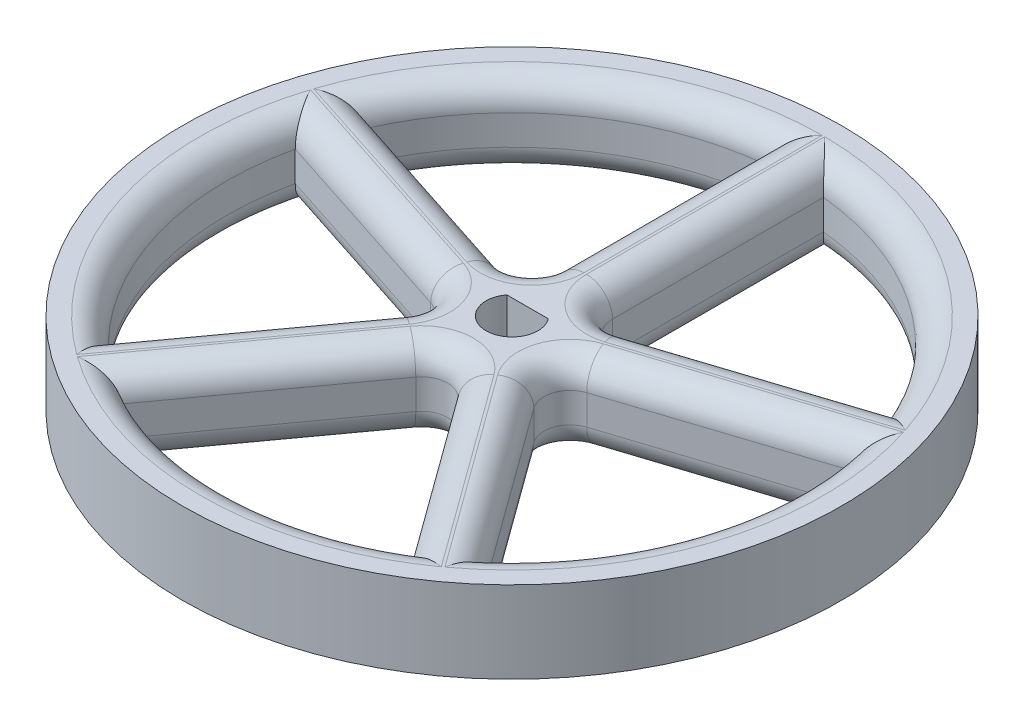
from build123d import *

# Parameters (mm, degrees)
SKETCH4_R           = 25.4
BOSS_EXTRUDE4_DEPTH = 6.3
FILLET6_R           = 2
FILLET7_R           = 2


with BuildPart() as part:
    # Sketch4 → Boss-Extrude4 (new body)
    with BuildSketch(Plane(origin=(0, 0, 0), x_dir=(1, 0, 0), z_dir=(0, 1, 0))):
        with Locations((-0.674307, 0)):
            Circle(SKETCH4_R)
        with BuildLine():
            Line((-0.674307, 1.2), (-2.274307, 1.2))
            ThreePointArc((-2.274307, 1.2), (-0.674307, -2), (0.925693, 1.2))
            Line((0.925693, 1.2), (-0.674307, 1.2))
        make_face(mode=Mode.SUBTRACT)
        with BuildLine():
            Line((-2.773413, 5.641936), (-2.773413, 21.899629))
            ThreePointArc((-2.773413, 21.899629), (-13.605582, 17.798374), (-20.853432, 8.763727))
            Line((-20.853432, 8.763727), (-5.391447, 3.739823))
            ThreePointArc((-5.391447, 3.739823), (-3.597843, 4.023902), (-2.773413, 5.641936))
        make_face(mode=Mode.SUBTRACT)
        with BuildLine():
            Line((1.4248, 5.641936), (1.4248, 21.899629))
            ThreePointArc((1.4248, 21.899629), (12.256969, 17.798374), (19.504819, 8.763727))
            Line((19.504819, 8.763727), (4.042834, 3.739823))
            ThreePointArc((4.042834, 3.739823), (2.24923, 4.023902), (1.4248, 5.641936))
        make_face(mode=Mode.SUBTRACT)
        with BuildLine():
            Line((5.340153, -0.252915), (20.802138, 4.770988))
            ThreePointArc((20.802138, 4.770988), (20.248937, -6.798374), (13.896185, -16.483348))
            Line((13.896185, -16.483348), (4.340153, -3.330598))
            ThreePointArc((4.340153, -3.330598), (4.056074, -1.536994), (5.340153, -0.252915))
        make_face(mode=Mode.SUBTRACT)
        with BuildLine():
            Line((0.943727, -5.798246), (10.499759, -18.950996))
            ThreePointArc((10.499759, -18.950996), (-0.674307, -22), (-11.848373, -18.950996))
            Line((-11.848373, -18.950996), (-2.292341, -5.798246))
            ThreePointArc((-2.292341, -5.798246), (-0.674307, -4.973817), (0.943727, -5.798246))
        make_face(mode=Mode.SUBTRACT)
        with BuildLine():
            Line((-5.688767, -3.330598), (-15.244799, -16.483348))
            ThreePointArc((-15.244799, -16.483348), (-21.59755, -6.798374), (-22.150751, 4.770988))
            Line((-22.150751, 4.770988), (-6.688767, -0.252915))
            ThreePointArc((-6.688767, -0.252915), (-5.404688, -1.536994), (-5.688767, -3.330598))
        make_face(mode=Mode.SUBTRACT)
    extrude(amount=BOSS_EXTRUDE4_DEPTH)

    # Fillet6
    fillet6_edges = [part.edges().sort_by_distance(p)[0] for p in [
        (-0.674307, 6.3, 22),
        (5.721743, 6.3, 12.374621),
        (-0.674307, 6.3, 4.973817),
        (-7.070357, 6.3, 12.374621),
        (-21.59755, 6.3, 6.798374),
        (-10.466783, 6.3, 9.906973),
        (-5.404688, 6.3, 1.536994),
        (-14.419759, 6.3, -2.259037),
        (-13.605582, 6.3, -17.798374),
        (-3.597843, 6.3, -4.023902),
        (-2.773413, 6.3, -13.770783),
        (2.24923, 6.3, -4.023902),
        (11.773826, 6.3, -6.251775),
        (12.256969, 6.3, -17.798374),
        (1.4248, 6.3, -13.770783),
        (4.056074, 6.3, 1.536994),
        (9.118169, 6.3, 9.906973),
        (20.248937, 6.3, 6.798374),
        (13.071146, 6.3, -2.259037),
        (-13.12244, 6.3, -6.251775),
    ]]
    fillet(fillet6_edges, radius=FILLET6_R)

    # Fillet7
    fillet7_edges = [part.edges().sort_by_distance(p)[0] for p in [
        (5.721743, 0, 12.374621),
        (-0.674307, 0, 22),
        (-7.070357, 0, 12.374621),
        (-0.674307, 0, 4.973817),
        (-10.466783, 0, 9.906973),
        (-21.59755, 0, 6.798374),
        (-14.419759, 0, -2.259037),
        (-5.404688, 0, 1.536994),
        (-13.12244, 0, -6.251775),
        (-13.605582, 0, -17.798374),
        (-2.773413, 0, -13.770783),
        (-3.597843, 0, -4.023902),
        (11.773826, 0, -6.251775),
        (2.24923, 0, -4.023902),
        (1.4248, 0, -13.770783),
        (12.256969, 0, -17.798374),
        (9.118169, 0, 9.906973),
        (4.056074, 0, 1.536994),
        (13.071146, 0, -2.259037),
        (20.248937, 0, 6.798374),
    ]]
    fillet(fillet7_edges, radius=FILLET7_R)


solid = part.part
